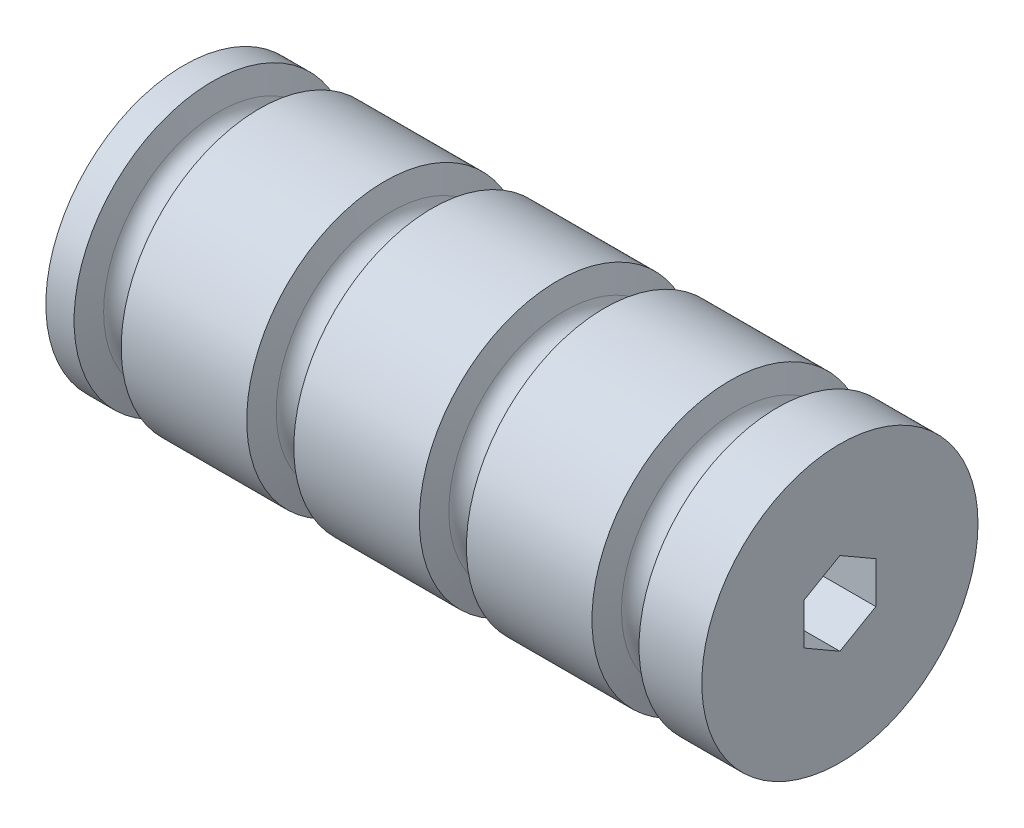
from build123d import *

# Parameters (mm, degrees)
SKETCH1_W          = 120.65
SKETCH1_H          = 25.4
CUT_EXTRUDE1_DEPTH = 126.88384527


with BuildPart() as part:
    # Sketch1 → Revolve1 (revolve)
    with BuildSketch(Plane.XY):
        with Locations((60.325, 12.7)):
            Rectangle(SKETCH1_W, SKETCH1_H)
    revolve(axis=Axis((0, 0, 0), (-1, 0, 0)))

    # Sketch2 → Cut-Revolve1 (revolve, cut)
    with BuildSketch(Plane.XY):
        with BuildLine():
            Line((5.194846373, 25.4), (6.496948681, 21.270259087))
            ThreePointArc((6.496948681, 21.270259087), (9.525, 19.05), (12.553051319, 21.270259087))
            Line((12.553051319, 21.270259087), (13.855153627, 25.4))
            Line((13.855153627, 25.4), (5.194846373, 25.4))
        make_face()
        with BuildLine():
            Line((36.944846373, 25.4), (38.246948681, 21.270259087))
            ThreePointArc((38.246948681, 21.270259087), (41.275, 19.05), (44.303051319, 21.270259087))
            Line((44.303051319, 21.270259087), (45.605153627, 25.4))
            Line((45.605153627, 25.4), (36.944846373, 25.4))
        make_face()
        with BuildLine():
            Line((68.694846373, 25.4), (69.996948681, 21.270259087))
            ThreePointArc((69.996948681, 21.270259087), (73.025, 19.05), (76.053051319, 21.270259087))
            Line((76.053051319, 21.270259087), (77.355153627, 25.4))
            Line((77.355153627, 25.4), (68.694846373, 25.4))
        make_face()
        with BuildLine():
            Line((100.444846373, 25.4), (101.746948681, 21.270259087))
            ThreePointArc((101.746948681, 21.270259087), (104.775, 19.05), (107.803051319, 21.270259087))
            Line((107.803051319, 21.270259087), (109.105153627, 25.4))
            Line((109.105153627, 25.4), (100.444846373, 25.4))
        make_face()
    revolve(axis=Axis((0, 0, 0), (-1, 0, 0)), mode=Mode.SUBTRACT)

    # Sketch3 → Cut-Extrude1 (cut, through all)
    with BuildSketch(Plane.ZY):
        Polygon((0, 7.625642355), (-6.604, 3.812821178), (-6.604, -3.812821178), (0, -7.625642355), (6.604, -3.812821178), (6.604, 3.812821178), align=None)
    extrude(amount=-CUT_EXTRUDE1_DEPTH, mode=Mode.SUBTRACT)


solid = part.part
